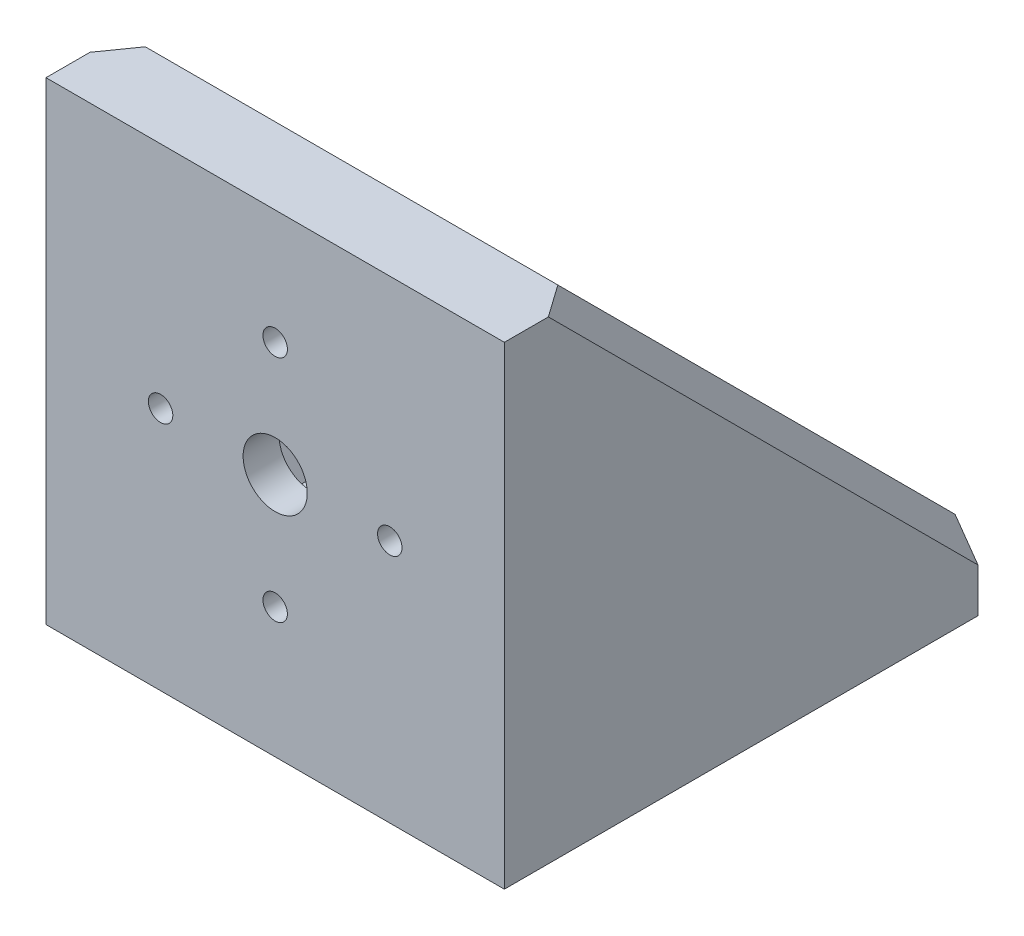
from build123d import *

# Parameters (mm, degrees)
BODY_DEPTH                       = 60
SUPPORT_ARM_DEPTH                = 10
HOLES_REACH                      = 102.737
SKETCH3_R                        = 4.2
SKETCH3_R_2                      = 1.6
SHAFT_HOLE_COUNTERBORE_DEPTH     = 5.3
MOUNTING_HOLES_COUNTERBORE_DEPTH = 3.5


with BuildPart() as part:
    # Sketch1 → Body (new body)
    with BuildSketch(Plane(origin=(0, 0, 0), x_dir=(0, 0, -1), z_dir=(1, 0, 0))):
        Polygon((0, 62), (0, 0), (62, 0), (62, 10), (10, 10), (10, 62), align=None)
    extrude(amount=BODY_DEPTH)

    # Sketch2 → Support Arm (add)
    with BuildSketch(Plane(origin=(0, 0, 0), x_dir=(0, 0, -1), z_dir=(1, 0, 0))):
        Polygon((62, 10), (10, 10), (10, 62), align=None)
    support_arm = extrude(amount=SUPPORT_ARM_DEPTH)

    # Support Arm Mirror: Support Arm across plane
    add(support_arm.mirror(Plane(origin=(30, 0, 0), x_dir=(0, 0, 1), z_dir=(1, 0, 0))))

    # Sketch3 → Holes (cut, up to next)
    with BuildSketch(Plane(origin=(0, 0, -10), x_dir=(-1, 0, 0), z_dir=(0, 0, -1)), mode=Mode.PRIVATE) as holes_sk1:
        with Locations((-30, 32)):
            Circle(SKETCH3_R)
    holes_tool1 = extrude(holes_sk1.sketch, amount=-HOLES_REACH, mode=Mode.PRIVATE) & part.part
    # Sketch3 → Holes (cut, up to next)
    with BuildSketch(Plane(origin=(0, 0, -10), x_dir=(-1, 0, 0), z_dir=(0, 0, -1)), mode=Mode.PRIVATE) as holes_sk2:
        with Locations((-30, 47)):
            Circle(SKETCH3_R_2)
    holes_tool2 = extrude(holes_sk2.sketch, amount=-HOLES_REACH, mode=Mode.PRIVATE) & part.part
    # Sketch3 → Holes (cut, up to next)
    with BuildSketch(Plane(origin=(0, 0, -10), x_dir=(-1, 0, 0), z_dir=(0, 0, -1)), mode=Mode.PRIVATE) as holes_sk3:
        with Locations((-15, 32)):
            Circle(SKETCH3_R_2)
    holes_tool3 = extrude(holes_sk3.sketch, amount=-HOLES_REACH, mode=Mode.PRIVATE) & part.part
    # Sketch3 → Holes (cut, up to next)
    with BuildSketch(Plane(origin=(0, 0, -10), x_dir=(-1, 0, 0), z_dir=(0, 0, -1)), mode=Mode.PRIVATE) as holes_sk4:
        with Locations((-30, 17)):
            Circle(SKETCH3_R_2)
    holes_tool4 = extrude(holes_sk4.sketch, amount=-HOLES_REACH, mode=Mode.PRIVATE) & part.part
    # Sketch3 → Holes (cut, up to next)
    with BuildSketch(Plane(origin=(0, 0, -10), x_dir=(-1, 0, 0), z_dir=(0, 0, -1)), mode=Mode.PRIVATE) as holes_sk5:
        with Locations((-45, 32)):
            Circle(SKETCH3_R_2)
    holes_tool5 = extrude(holes_sk5.sketch, amount=-HOLES_REACH, mode=Mode.PRIVATE) & part.part
    holes_1 = holes_tool1.solids().sort_by_distance((30, 32, -10))[0]
    add(holes_1, mode=Mode.SUBTRACT)
    holes_2 = holes_tool2.solids().sort_by_distance((30, 47, -10))[0]
    add(holes_2, mode=Mode.SUBTRACT)
    holes_3 = holes_tool3.solids().sort_by_distance((15, 32, -10))[0]
    add(holes_3, mode=Mode.SUBTRACT)
    holes_4 = holes_tool4.solids().sort_by_distance((30, 17, -10))[0]
    add(holes_4, mode=Mode.SUBTRACT)
    holes_5 = holes_tool5.solids().sort_by_distance((45, 32, -10))[0]
    add(holes_5, mode=Mode.SUBTRACT)
    holes = holes_1 + holes_2 + holes_3 + holes_4 + holes_5  # Holes as one shape, for the pattern or mirror that repeats it

    # Sketch5 → Shaft Hole Counterbore (cut)
    with BuildSketch(Plane(origin=(0, 0, -10), x_dir=(-1, 0, 0), z_dir=(0, 0, -1))):
        Polygon((-26.189488223, 38.6), (-33.810511777, 38.6), (-37.621023553, 32), (-33.810511777, 25.4), (-26.189488223, 25.4), (-22.378976447, 32), align=None)
    shaft_hole_counterbore = extrude(amount=-SHAFT_HOLE_COUNTERBORE_DEPTH, mode=Mode.SUBTRACT)

    # Sketch6 → Mounting Holes Counterbore (cut)
    with BuildSketch(Plane(origin=(0, 0, -10), x_dir=(-1, 0, 0), z_dir=(0, 0, -1))):
        Polygon((-12.15, 30.354551733), (-12.15, 33.645448267), (-15, 35.290896534), (-17.85, 33.645448267), (-17.85, 30.354551733), (-15, 28.709103466), align=None)
        Polygon((-28.354551733, 49.85), (-31.645448267, 49.85), (-33.290896534, 47), (-31.645448267, 44.15), (-28.354551733, 44.15), (-26.709103466, 47), align=None)
        Polygon((-31.645448267, 14.15), (-28.354551733, 14.15), (-26.709103466, 17), (-28.354551733, 19.85), (-31.645448267, 19.85), (-33.290896534, 17), align=None)
        Polygon((-47.85, 33.645448267), (-47.85, 30.354551733), (-45, 28.709103466), (-42.15, 30.354551733), (-42.15, 33.645448267), (-45, 35.290896534), align=None)
    mounting_holes_counterbore = extrude(amount=-MOUNTING_HOLES_COUNTERBORE_DEPTH, mode=Mode.SUBTRACT)

    # Mounting Feature Mirror: Holes, Shaft Hole Counterbore, Mounting Holes Counterbore across plane
    add(holes.mirror(Plane(origin=(0, 0, 0), x_dir=(0, -0.7071067811865489, 0.7071067811865462), z_dir=(0, 0.7071067811865464, 0.7071067811865488))), mode=Mode.SUBTRACT)
    add(shaft_hole_counterbore.mirror(Plane(origin=(0, 0, 0), x_dir=(0, -0.7071067811865489, 0.7071067811865462), z_dir=(0, 0.7071067811865464, 0.7071067811865488))), mode=Mode.SUBTRACT)
    add(mounting_holes_counterbore.mirror(Plane(origin=(0, 0, 0), x_dir=(0, -0.7071067811865489, 0.7071067811865462), z_dir=(0, 0.7071067811865464, 0.7071067811865488))), mode=Mode.SUBTRACT)

    # Chamfer1
    # the kernel refuses this chamfer: 3 mm, written as the material it adds along each edge
    with BuildSketch(Plane(origin=(48, 12, -12), x_dir=(0.7071067811865476, 0.7071067811865476, 0), z_dir=(0.5773502691896257, -0.5773502691896257, 0.5773502691896257))) as chamfer1_piece_1_section:
        Polygon((-2.121320344, -1.224744871), (2.121320344, -1.224744871), (0, 2.449489743), align=None)
    chamfer1_piece_1 = extrude(amount=3.810511777, mode=Mode.PRIVATE)
    chamfer1_piece_1 = split(chamfer1_piece_1, bisect_by=Plane(origin=(50, 10, -10), z_dir=(0, 1, 0)), keep=Keep.TOP, mode=Mode.PRIVATE)
    chamfer1_piece_1 = split(chamfer1_piece_1, bisect_by=Plane(origin=(50, 10, -10), z_dir=(-1, 0, 0)), keep=Keep.TOP, mode=Mode.PRIVATE)
    chamfer1_piece_1 = split(chamfer1_piece_1, bisect_by=Plane(origin=(50, 10, -10), z_dir=(0, 0, -1)), keep=Keep.TOP, mode=Mode.PRIVATE)
    add(chamfer1_piece_1)
    with BuildSketch(Plane(origin=(12, 12, -12), x_dir=(0.7071067811865476, -0.7071067811865476, 0), z_dir=(-0.5773502691896257, -0.5773502691896257, 0.5773502691896257))) as chamfer1_piece_2_section:
        Polygon((-2.121320344, -1.224744871), (2.121320344, -1.224744871), (0, 2.449489743), align=None)
    chamfer1_piece_2 = extrude(amount=3.810511777, mode=Mode.PRIVATE)
    chamfer1_piece_2 = split(chamfer1_piece_2, bisect_by=Plane(origin=(10, 10, -10), z_dir=(1, 0, 0)), keep=Keep.TOP, mode=Mode.PRIVATE)
    chamfer1_piece_2 = split(chamfer1_piece_2, bisect_by=Plane(origin=(10, 10, -10), z_dir=(0, 1, 0)), keep=Keep.TOP, mode=Mode.PRIVATE)
    chamfer1_piece_2 = split(chamfer1_piece_2, bisect_by=Plane(origin=(10, 10, -10), z_dir=(0, 0, -1)), keep=Keep.TOP, mode=Mode.PRIVATE)
    add(chamfer1_piece_2)
    with BuildSketch(Plane(origin=(50, 10, -62), x_dir=(-0.9996219169112968, -0.02749587661058619, 0), z_dir=(0, 0, 1))) as chamfer1_piece_3_section:
        with BuildLine():
            Line((3.086019586, 0), (-0.169641465, -3.081353381))
            Line((-0.169641465, -3.081353381), (-0.22961878, -3.079703628))
            ThreePointArc((-0.22961878, -3.079703628), (-0.102387681, -1.540193489), (-0.059977315, 0.001649753))
            Line((-0.059977315, 0.001649753), (0.001649753, 0.059977315))
            ThreePointArc((0.001649753, 0.059977315), (1.543492994, 0.017566949), (3.087669338, 0.059977315))
            Line((3.087669338, 0.059977315), (3.086019586, 0))
        make_face()
    chamfer1_piece_3 = extrude(amount=59.715048964, mode=Mode.PRIVATE)
    chamfer1_piece_3 = split(chamfer1_piece_3, bisect_by=Plane(origin=(47.520469287, 17.200125575, -54.799874425), z_dir=(0, -0.7071067811865476, 0.7071067811865476)), keep=Keep.TOP, mode=Mode.PRIVATE)
    chamfer1_piece_3 = split(chamfer1_piece_3, bisect_by=Plane(origin=(47.85, 10.207829638, -47.807578488), z_dir=(-1, 0, 0)), keep=Keep.TOP, mode=Mode.PRIVATE)
    chamfer1_piece_3 = split(chamfer1_piece_3, bisect_by=Plane(origin=(41.470469694, 10.207829638, -37.328671807), z_dir=(0.5000000000000014, 6.5682216370568426e-15, -0.8660254037844379)), keep=Keep.TOP, mode=Mode.PRIVATE)
    add(chamfer1_piece_3)
    with BuildSketch(Plane(origin=(50, 10, -62), x_dir=(-0.9996219169112968, -0.02749587661058619, 0), z_dir=(0, 0, 1))) as chamfer1_piece_4_section:
        with BuildLine():
            Line((3.086019586, 0), (-0.169641465, -3.081353381))
            Line((-0.169641465, -3.081353381), (-0.22961878, -3.079703628))
            ThreePointArc((-0.22961878, -3.079703628), (-0.102387681, -1.540193489), (-0.059977315, 0.001649753))
            Line((-0.059977315, 0.001649753), (0.001649753, 0.059977315))
            ThreePointArc((0.001649753, 0.059977315), (1.543492994, 0.017566949), (3.087669338, 0.059977315))
            Line((3.087669338, 0.059977315), (3.086019586, 0))
        make_face()
    chamfer1_piece_4 = extrude(amount=59.715048964, mode=Mode.PRIVATE)
    chamfer1_piece_4 = split(chamfer1_piece_4, bisect_by=Plane(origin=(49.164389767, 18.069084369, -53.930915631), z_dir=(0, -0.7071067811865476, 0.7071067811865476)), keep=Keep.TOP, mode=Mode.PRIVATE)
    chamfer1_piece_4 = split(chamfer1_piece_4, bisect_by=Plane(origin=(47.85, 11.05402215, -46.915853412), z_dir=(1, 0, 0)), keep=Keep.TOP, mode=Mode.PRIVATE)
    chamfer1_piece_4 = split(chamfer1_piece_4, bisect_by=Plane(origin=(43.089538338, 11.05402215, -36.393902089), z_dir=(0.5000000000000014, 6.5682216370568426e-15, -0.8660254037844379)), keep=Keep.TOP, mode=Mode.PRIVATE)
    add(chamfer1_piece_4)
    with BuildSketch(Plane(origin=(50, 10, -62), x_dir=(-0.9996219169112968, -0.02749587661058619, 0), z_dir=(0, 0, 1))) as chamfer1_piece_5_section:
        with BuildLine():
            Line((3.086019586, 0), (-0.169641465, -3.081353381))
            Line((-0.169641465, -3.081353381), (-0.22961878, -3.079703628))
            ThreePointArc((-0.22961878, -3.079703628), (-0.102387681, -1.540193489), (-0.059977315, 0.001649753))
            Line((-0.059977315, 0.001649753), (0.001649753, 0.059977315))
            ThreePointArc((0.001649753, 0.059977315), (1.543492994, 0.017566949), (3.087669338, 0.059977315))
            Line((3.087669338, 0.059977315), (3.086019586, 0))
        make_face()
    chamfer1_piece_5 = extrude(amount=59.715048964, mode=Mode.PRIVATE)
    chamfer1_piece_5 = split(chamfer1_piece_5, bisect_by=Plane(origin=(47.85, 10.93810197, -32), z_dir=(1, 0, 0)), keep=Keep.TOP, mode=Mode.PRIVATE)
    chamfer1_piece_5 = split(chamfer1_piece_5, bisect_by=Plane(origin=(49.365911498, 10.93810197, -31.229763644), z_dir=(-0.5000000000000003, 0, -0.8660254037844385)), keep=Keep.TOP, mode=Mode.PRIVATE)
    chamfer1_piece_5 = split(chamfer1_piece_5, bisect_by=Plane(origin=(49.365911498, 10.93810197, -32.770236356), z_dir=(-0.5000000000000014, -6.5682216370568426e-15, 0.8660254037844379)), keep=Keep.TOP, mode=Mode.PRIVATE)
    add(chamfer1_piece_5)
    with BuildSketch(Plane(origin=(50, 10, -62), x_dir=(-0.9996219169112968, -0.02749587661058619, 0), z_dir=(0, 0, 1))) as chamfer1_piece_6_section:
        with BuildLine():
            Line((3.086019586, 0), (-0.169641465, -3.081353381))
            Line((-0.169641465, -3.081353381), (-0.22961878, -3.079703628))
            ThreePointArc((-0.22961878, -3.079703628), (-0.102387681, -1.540193489), (-0.059977315, 0.001649753))
            Line((-0.059977315, 0.001649753), (0.001649753, 0.059977315))
            ThreePointArc((0.001649753, 0.059977315), (1.543492994, 0.017566949), (3.087669338, 0.059977315))
            Line((3.087669338, 0.059977315), (3.086019586, 0))
        make_face()
    chamfer1_piece_6 = extrude(amount=59.715048964, mode=Mode.PRIVATE)
    chamfer1_piece_6 = split(chamfer1_piece_6, bisect_by=Plane(origin=(47.85, 10.209544555, -16.224893172), z_dir=(-1, 0, 0)), keep=Keep.TOP, mode=Mode.PRIVATE)
    chamfer1_piece_6 = split(chamfer1_piece_6, bisect_by=Plane(origin=(41.485229504, 10.209544555, -26.679849774), z_dir=(0.5000000000000003, 0, 0.8660254037844385)), keep=Keep.TOP, mode=Mode.PRIVATE)
    add(chamfer1_piece_6)
    with BuildSketch(Plane(origin=(50, 10, -62), x_dir=(-0.9996219169112968, -0.02749587661058619, 0), z_dir=(0, 0, 1))) as chamfer1_piece_7_section:
        with BuildLine():
            Line((3.086019586, 0), (-0.169641465, -3.081353381))
            Line((-0.169641465, -3.081353381), (-0.22961878, -3.079703628))
            ThreePointArc((-0.22961878, -3.079703628), (-0.102387681, -1.540193489), (-0.059977315, 0.001649753))
            Line((-0.059977315, 0.001649753), (0.001649753, 0.059977315))
            ThreePointArc((0.001649753, 0.059977315), (1.543492994, 0.017566949), (3.087669338, 0.059977315))
            Line((3.087669338, 0.059977315), (3.086019586, 0))
        make_face()
    chamfer1_piece_7 = extrude(amount=59.715048964, mode=Mode.PRIVATE)
    chamfer1_piece_7 = split(chamfer1_piece_7, bisect_by=Plane(origin=(47.85, 11.073699884, -16.701199578), z_dir=(1, 0, 0)), keep=Keep.TOP, mode=Mode.PRIVATE)
    chamfer1_piece_7 = split(chamfer1_piece_7, bisect_by=Plane(origin=(42.928956571, 11.073699884, -27.513385984), z_dir=(0.5000000000000003, 0, 0.8660254037844385)), keep=Keep.TOP, mode=Mode.PRIVATE)
    add(chamfer1_piece_7)
    with BuildSketch(Plane(origin=(50, 2.284951036, -10), x_dir=(-0.9996219169112968, 0, 0.02749587661058619), z_dir=(0, 1, 0))) as chamfer1_piece_8_section:
        with BuildLine():
            Line((3.086019586, 0), (-0.169641465, -3.081353381))
            Line((-0.169641465, -3.081353381), (-0.22961878, -3.079703628))
            ThreePointArc((-0.22961878, -3.079703628), (-0.102387681, -1.540193489), (-0.059977315, 0.001649753))
            Line((-0.059977315, 0.001649753), (0.001649753, 0.059977315))
            ThreePointArc((0.001649753, 0.059977315), (1.543492994, 0.017566949), (3.087669338, 0.059977315))
            Line((3.087669338, 0.059977315), (3.086019586, 0))
        make_face()
    chamfer1_piece_8 = extrude(amount=59.715048964, mode=Mode.PRIVATE)
    chamfer1_piece_8 = split(chamfer1_piece_8, bisect_by=Plane(origin=(41.485229504, 26.679849774, -10.209544555), z_dir=(0.5000000000000003, -0.8660254037844387, -3.4914813388431365e-15)), keep=Keep.TOP, mode=Mode.PRIVATE)
    chamfer1_piece_8 = split(chamfer1_piece_8, bisect_by=Plane(origin=(47.85, 16.224893172, -10.209544555), z_dir=(-1, 0, 0)), keep=Keep.TOP, mode=Mode.PRIVATE)
    add(chamfer1_piece_8)
    with BuildSketch(Plane(origin=(50, 2.284951036, -10), x_dir=(-0.9996219169112968, 0, 0.02749587661058619), z_dir=(0, 1, 0))) as chamfer1_piece_9_section:
        with BuildLine():
            Line((3.086019586, 0), (-0.169641465, -3.081353381))
            Line((-0.169641465, -3.081353381), (-0.22961878, -3.079703628))
            ThreePointArc((-0.22961878, -3.079703628), (-0.102387681, -1.540193489), (-0.059977315, 0.001649753))
            Line((-0.059977315, 0.001649753), (0.001649753, 0.059977315))
            ThreePointArc((0.001649753, 0.059977315), (1.543492994, 0.017566949), (3.087669338, 0.059977315))
            Line((3.087669338, 0.059977315), (3.086019586, 0))
        make_face()
    chamfer1_piece_9 = extrude(amount=59.715048964, mode=Mode.PRIVATE)
    chamfer1_piece_9 = split(chamfer1_piece_9, bisect_by=Plane(origin=(42.928956571, 27.513385984, -11.073699884), z_dir=(0.5000000000000003, -0.8660254037844387, -3.4914813388431365e-15)), keep=Keep.TOP, mode=Mode.PRIVATE)
    chamfer1_piece_9 = split(chamfer1_piece_9, bisect_by=Plane(origin=(47.85, 16.701199578, -11.073699884), z_dir=(1, 0, 0)), keep=Keep.TOP, mode=Mode.PRIVATE)
    add(chamfer1_piece_9)
    with BuildSketch(Plane(origin=(50, 2.284951036, -10), x_dir=(-0.9996219169112968, 0, 0.02749587661058619), z_dir=(0, 1, 0))) as chamfer1_piece_10_section:
        with BuildLine():
            Line((3.086019586, 0), (-0.169641465, -3.081353381))
            Line((-0.169641465, -3.081353381), (-0.22961878, -3.079703628))
            ThreePointArc((-0.22961878, -3.079703628), (-0.102387681, -1.540193489), (-0.059977315, 0.001649753))
            Line((-0.059977315, 0.001649753), (0.001649753, 0.059977315))
            ThreePointArc((0.001649753, 0.059977315), (1.543492994, 0.017566949), (3.087669338, 0.059977315))
            Line((3.087669338, 0.059977315), (3.086019586, 0))
        make_face()
    chamfer1_piece_10 = extrude(amount=59.715048964, mode=Mode.PRIVATE)
    chamfer1_piece_10 = split(chamfer1_piece_10, bisect_by=Plane(origin=(49.365911498, 32.770236356, -10.93810197), z_dir=(-0.5000000000000013, -0.8660254037844379, 3.4914813388431432e-15)), keep=Keep.TOP, mode=Mode.PRIVATE)
    chamfer1_piece_10 = split(chamfer1_piece_10, bisect_by=Plane(origin=(49.365911498, 31.229763644, -10.93810197), z_dir=(-0.5000000000000003, 0.8660254037844387, 3.4914813388431365e-15)), keep=Keep.TOP, mode=Mode.PRIVATE)
    chamfer1_piece_10 = split(chamfer1_piece_10, bisect_by=Plane(origin=(47.85, 32, -10.93810197), z_dir=(1, 0, 0)), keep=Keep.TOP, mode=Mode.PRIVATE)
    add(chamfer1_piece_10)
    with BuildSketch(Plane(origin=(50, 2.284951036, -10), x_dir=(-0.9996219169112968, 0, 0.02749587661058619), z_dir=(0, 1, 0))) as chamfer1_piece_11_section:
        with BuildLine():
            Line((3.086019586, 0), (-0.169641465, -3.081353381))
            Line((-0.169641465, -3.081353381), (-0.22961878, -3.079703628))
            ThreePointArc((-0.22961878, -3.079703628), (-0.102387681, -1.540193489), (-0.059977315, 0.001649753))
            Line((-0.059977315, 0.001649753), (0.001649753, 0.059977315))
            ThreePointArc((0.001649753, 0.059977315), (1.543492994, 0.017566949), (3.087669338, 0.059977315))
            Line((3.087669338, 0.059977315), (3.086019586, 0))
        make_face()
    chamfer1_piece_11 = extrude(amount=59.715048964, mode=Mode.PRIVATE)
    chamfer1_piece_11 = split(chamfer1_piece_11, bisect_by=Plane(origin=(41.470469694, 37.328671807, -10.207829638), z_dir=(0.5000000000000013, 0.8660254037844379, -3.4914813388431432e-15)), keep=Keep.TOP, mode=Mode.PRIVATE)
    chamfer1_piece_11 = split(chamfer1_piece_11, bisect_by=Plane(origin=(47.85, 47.807578488, -10.207829638), z_dir=(-1, 0, 0)), keep=Keep.TOP, mode=Mode.PRIVATE)
    chamfer1_piece_11 = split(chamfer1_piece_11, bisect_by=Plane(origin=(47.520469287, 54.799874425, -17.200125575), z_dir=(0, -0.7071067811865476, 0.7071067811865476)), keep=Keep.TOP, mode=Mode.PRIVATE)
    add(chamfer1_piece_11)
    with BuildSketch(Plane(origin=(50, 2.284951036, -10), x_dir=(-0.9996219169112968, 0, 0.02749587661058619), z_dir=(0, 1, 0))) as chamfer1_piece_12_section:
        with BuildLine():
            Line((3.086019586, 0), (-0.169641465, -3.081353381))
            Line((-0.169641465, -3.081353381), (-0.22961878, -3.079703628))
            ThreePointArc((-0.22961878, -3.079703628), (-0.102387681, -1.540193489), (-0.059977315, 0.001649753))
            Line((-0.059977315, 0.001649753), (0.001649753, 0.059977315))
            ThreePointArc((0.001649753, 0.059977315), (1.543492994, 0.017566949), (3.087669338, 0.059977315))
            Line((3.087669338, 0.059977315), (3.086019586, 0))
        make_face()
    chamfer1_piece_12 = extrude(amount=59.715048964, mode=Mode.PRIVATE)
    chamfer1_piece_12 = split(chamfer1_piece_12, bisect_by=Plane(origin=(43.089538338, 36.393902089, -11.05402215), z_dir=(0.5000000000000013, 0.8660254037844379, -3.4914813388431432e-15)), keep=Keep.TOP, mode=Mode.PRIVATE)
    chamfer1_piece_12 = split(chamfer1_piece_12, bisect_by=Plane(origin=(47.85, 46.915853412, -11.05402215), z_dir=(1, 0, 0)), keep=Keep.TOP, mode=Mode.PRIVATE)
    chamfer1_piece_12 = split(chamfer1_piece_12, bisect_by=Plane(origin=(49.164389767, 53.930915631, -18.069084369), z_dir=(0, -0.7071067811865476, 0.7071067811865476)), keep=Keep.TOP, mode=Mode.PRIVATE)
    add(chamfer1_piece_12)
    with BuildSketch(Plane(origin=(10, 10, -62), x_dir=(-0.027495876610586206, 0.9996219169112968, 0), z_dir=(0, 0, 1))) as chamfer1_piece_13_section:
        with BuildLine():
            Line((3.086019586, 0), (-0.169641465, -3.081353381))
            Line((-0.169641465, -3.081353381), (-0.22961878, -3.079703628))
            ThreePointArc((-0.22961878, -3.079703628), (-0.102387681, -1.540193489), (-0.059977315, 0.001649753))
            Line((-0.059977315, 0.001649753), (0.001649753, 0.059977315))
            ThreePointArc((0.001649753, 0.059977315), (1.543492994, 0.017566949), (3.087669338, 0.059977315))
            Line((3.087669338, 0.059977315), (3.086019586, 0))
        make_face()
    chamfer1_piece_13 = extrude(amount=59.715048964, mode=Mode.PRIVATE)
    chamfer1_piece_13 = split(chamfer1_piece_13, bisect_by=Plane(origin=(10.835610233, 18.069084369, -53.930915631), z_dir=(0, -0.7071067811865476, 0.7071067811865476)), keep=Keep.TOP, mode=Mode.PRIVATE)
    chamfer1_piece_13 = split(chamfer1_piece_13, bisect_by=Plane(origin=(12.15, 11.05402215, -46.915853412), z_dir=(-1, 0, 0)), keep=Keep.TOP, mode=Mode.PRIVATE)
    chamfer1_piece_13 = split(chamfer1_piece_13, bisect_by=Plane(origin=(16.910461662, 11.05402215, -36.393902089), z_dir=(-0.4999999999999997, 0, -0.8660254037844388)), keep=Keep.TOP, mode=Mode.PRIVATE)
    add(chamfer1_piece_13)
    with BuildSketch(Plane(origin=(10, 10, -62), x_dir=(-0.027495876610586206, 0.9996219169112968, 0), z_dir=(0, 0, 1))) as chamfer1_piece_14_section:
        with BuildLine():
            Line((3.086019586, 0), (-0.169641465, -3.081353381))
            Line((-0.169641465, -3.081353381), (-0.22961878, -3.079703628))
            ThreePointArc((-0.22961878, -3.079703628), (-0.102387681, -1.540193489), (-0.059977315, 0.001649753))
            Line((-0.059977315, 0.001649753), (0.001649753, 0.059977315))
            ThreePointArc((0.001649753, 0.059977315), (1.543492994, 0.017566949), (3.087669338, 0.059977315))
            Line((3.087669338, 0.059977315), (3.086019586, 0))
        make_face()
    chamfer1_piece_14 = extrude(amount=59.715048964, mode=Mode.PRIVATE)
    chamfer1_piece_14 = split(chamfer1_piece_14, bisect_by=Plane(origin=(12.479530713, 17.200125575, -54.799874425), z_dir=(0, -0.7071067811865476, 0.7071067811865476)), keep=Keep.TOP, mode=Mode.PRIVATE)
    chamfer1_piece_14 = split(chamfer1_piece_14, bisect_by=Plane(origin=(12.15, 10.207829638, -47.807578488), z_dir=(1, 0, 0)), keep=Keep.TOP, mode=Mode.PRIVATE)
    chamfer1_piece_14 = split(chamfer1_piece_14, bisect_by=Plane(origin=(18.529530306, 10.207829638, -37.328671807), z_dir=(-0.4999999999999997, 0, -0.8660254037844388)), keep=Keep.TOP, mode=Mode.PRIVATE)
    add(chamfer1_piece_14)
    with BuildSketch(Plane(origin=(10, 10, -62), x_dir=(-0.027495876610586206, 0.9996219169112968, 0), z_dir=(0, 0, 1))) as chamfer1_piece_15_section:
        with BuildLine():
            Line((3.086019586, 0), (-0.169641465, -3.081353381))
            Line((-0.169641465, -3.081353381), (-0.22961878, -3.079703628))
            ThreePointArc((-0.22961878, -3.079703628), (-0.102387681, -1.540193489), (-0.059977315, 0.001649753))
            Line((-0.059977315, 0.001649753), (0.001649753, 0.059977315))
            ThreePointArc((0.001649753, 0.059977315), (1.543492994, 0.017566949), (3.087669338, 0.059977315))
            Line((3.087669338, 0.059977315), (3.086019586, 0))
        make_face()
    chamfer1_piece_15 = extrude(amount=59.715048964, mode=Mode.PRIVATE)
    chamfer1_piece_15 = split(chamfer1_piece_15, bisect_by=Plane(origin=(12.15, 10.93810197, -32), z_dir=(-1, 0, 0)), keep=Keep.TOP, mode=Mode.PRIVATE)
    chamfer1_piece_15 = split(chamfer1_piece_15, bisect_by=Plane(origin=(10.634088502, 10.93810197, -32.770236356), z_dir=(0.4999999999999997, 0, 0.8660254037844388)), keep=Keep.TOP, mode=Mode.PRIVATE)
    chamfer1_piece_15 = split(chamfer1_piece_15, bisect_by=Plane(origin=(10.634088502, 10.93810197, -31.229763644), z_dir=(0.5000000000000008, 6.568221637056838e-15, -0.8660254037844384)), keep=Keep.TOP, mode=Mode.PRIVATE)
    add(chamfer1_piece_15)
    with BuildSketch(Plane(origin=(10, 10, -62), x_dir=(-0.027495876610586206, 0.9996219169112968, 0), z_dir=(0, 0, 1))) as chamfer1_piece_16_section:
        with BuildLine():
            Line((3.086019586, 0), (-0.169641465, -3.081353381))
            Line((-0.169641465, -3.081353381), (-0.22961878, -3.079703628))
            ThreePointArc((-0.22961878, -3.079703628), (-0.102387681, -1.540193489), (-0.059977315, 0.001649753))
            Line((-0.059977315, 0.001649753), (0.001649753, 0.059977315))
            ThreePointArc((0.001649753, 0.059977315), (1.543492994, 0.017566949), (3.087669338, 0.059977315))
            Line((3.087669338, 0.059977315), (3.086019586, 0))
        make_face()
    chamfer1_piece_16 = extrude(amount=59.715048964, mode=Mode.PRIVATE)
    chamfer1_piece_16 = split(chamfer1_piece_16, bisect_by=Plane(origin=(12.15, 11.073699884, -16.701199578), z_dir=(-1, 0, 0)), keep=Keep.TOP, mode=Mode.PRIVATE)
    chamfer1_piece_16 = split(chamfer1_piece_16, bisect_by=Plane(origin=(17.071043429, 11.073699884, -27.513385984), z_dir=(-0.5000000000000008, -6.568221637056838e-15, 0.8660254037844384)), keep=Keep.TOP, mode=Mode.PRIVATE)
    add(chamfer1_piece_16)
    with BuildSketch(Plane(origin=(10, 10, -62), x_dir=(-0.027495876610586206, 0.9996219169112968, 0), z_dir=(0, 0, 1))) as chamfer1_piece_17_section:
        with BuildLine():
            Line((3.086019586, 0), (-0.169641465, -3.081353381))
            Line((-0.169641465, -3.081353381), (-0.22961878, -3.079703628))
            ThreePointArc((-0.22961878, -3.079703628), (-0.102387681, -1.540193489), (-0.059977315, 0.001649753))
            Line((-0.059977315, 0.001649753), (0.001649753, 0.059977315))
            ThreePointArc((0.001649753, 0.059977315), (1.543492994, 0.017566949), (3.087669338, 0.059977315))
            Line((3.087669338, 0.059977315), (3.086019586, 0))
        make_face()
    chamfer1_piece_17 = extrude(amount=59.715048964, mode=Mode.PRIVATE)
    chamfer1_piece_17 = split(chamfer1_piece_17, bisect_by=Plane(origin=(12.15, 10.209544555, -16.224893172), z_dir=(1, 0, 0)), keep=Keep.TOP, mode=Mode.PRIVATE)
    chamfer1_piece_17 = split(chamfer1_piece_17, bisect_by=Plane(origin=(18.514770496, 10.209544555, -26.679849774), z_dir=(-0.5000000000000008, -6.568221637056838e-15, 0.8660254037844384)), keep=Keep.TOP, mode=Mode.PRIVATE)
    add(chamfer1_piece_17)
    with BuildSketch(Plane(origin=(10, 2.284951036, -10), x_dir=(0.9996219169112969, 0, 0.02749587661058621), z_dir=(0, 1, 0))) as chamfer1_piece_18_section:
        with BuildLine():
            Line((3.086019586, 0), (-0.169641465, 3.081353381))
            Line((-0.169641465, 3.081353381), (-0.22961878, 3.079703628))
            ThreePointArc((-0.22961878, 3.079703628), (-0.102387681, 1.540193489), (-0.059977315, -0.001649753))
            Line((-0.059977315, -0.001649753), (0.001649753, -0.059977315))
            ThreePointArc((0.001649753, -0.059977315), (1.543492994, -0.017566949), (3.087669338, -0.059977315))
            Line((3.087669338, -0.059977315), (3.086019586, 0))
        make_face()
    chamfer1_piece_18 = extrude(amount=59.715048964, mode=Mode.PRIVATE)
    chamfer1_piece_18 = split(chamfer1_piece_18, bisect_by=Plane(origin=(18.514770496, 26.679849774, -10.209544555), z_dir=(-0.5000000000000007, -0.8660254037844384, 3.491481338843138e-15)), keep=Keep.TOP, mode=Mode.PRIVATE)
    chamfer1_piece_18 = split(chamfer1_piece_18, bisect_by=Plane(origin=(12.15, 16.224893172, -10.209544555), z_dir=(1, 0, 0)), keep=Keep.TOP, mode=Mode.PRIVATE)
    add(chamfer1_piece_18)
    with BuildSketch(Plane(origin=(10, 2.284951036, -10), x_dir=(0.9996219169112969, 0, 0.02749587661058621), z_dir=(0, 1, 0))) as chamfer1_piece_19_section:
        with BuildLine():
            Line((3.086019586, 0), (-0.169641465, 3.081353381))
            Line((-0.169641465, 3.081353381), (-0.22961878, 3.079703628))
            ThreePointArc((-0.22961878, 3.079703628), (-0.102387681, 1.540193489), (-0.059977315, -0.001649753))
            Line((-0.059977315, -0.001649753), (0.001649753, -0.059977315))
            ThreePointArc((0.001649753, -0.059977315), (1.543492994, -0.017566949), (3.087669338, -0.059977315))
            Line((3.087669338, -0.059977315), (3.086019586, 0))
        make_face()
    chamfer1_piece_19 = extrude(amount=59.715048964, mode=Mode.PRIVATE)
    chamfer1_piece_19 = split(chamfer1_piece_19, bisect_by=Plane(origin=(17.071043429, 27.513385984, -11.073699884), z_dir=(-0.5000000000000007, -0.8660254037844384, 3.491481338843138e-15)), keep=Keep.TOP, mode=Mode.PRIVATE)
    chamfer1_piece_19 = split(chamfer1_piece_19, bisect_by=Plane(origin=(12.15, 16.701199578, -11.073699884), z_dir=(-1, 0, 0)), keep=Keep.TOP, mode=Mode.PRIVATE)
    add(chamfer1_piece_19)
    with BuildSketch(Plane(origin=(10, 2.284951036, -10), x_dir=(0.9996219169112969, 0, 0.02749587661058621), z_dir=(0, 1, 0))) as chamfer1_piece_20_section:
        with BuildLine():
            Line((3.086019586, 0), (-0.169641465, 3.081353381))
            Line((-0.169641465, 3.081353381), (-0.22961878, 3.079703628))
            ThreePointArc((-0.22961878, 3.079703628), (-0.102387681, 1.540193489), (-0.059977315, -0.001649753))
            Line((-0.059977315, -0.001649753), (0.001649753, -0.059977315))
            ThreePointArc((0.001649753, -0.059977315), (1.543492994, -0.017566949), (3.087669338, -0.059977315))
            Line((3.087669338, -0.059977315), (3.086019586, 0))
        make_face()
    chamfer1_piece_20 = extrude(amount=59.715048964, mode=Mode.PRIVATE)
    chamfer1_piece_20 = split(chamfer1_piece_20, bisect_by=Plane(origin=(10.634088502, 31.229763644, -10.93810197), z_dir=(0.5000000000000007, 0.8660254037844384, -3.491481338843138e-15)), keep=Keep.TOP, mode=Mode.PRIVATE)
    chamfer1_piece_20 = split(chamfer1_piece_20, bisect_by=Plane(origin=(10.634088502, 32.770236356, -10.93810197), z_dir=(0.4999999999999997, -0.866025403784439, -3.4914813388431314e-15)), keep=Keep.TOP, mode=Mode.PRIVATE)
    chamfer1_piece_20 = split(chamfer1_piece_20, bisect_by=Plane(origin=(12.15, 32, -10.93810197), z_dir=(-1, 0, 0)), keep=Keep.TOP, mode=Mode.PRIVATE)
    add(chamfer1_piece_20)
    with BuildSketch(Plane(origin=(10, 2.284951036, -10), x_dir=(0.9996219169112969, 0, 0.02749587661058621), z_dir=(0, 1, 0))) as chamfer1_piece_21_section:
        with BuildLine():
            Line((3.086019586, 0), (-0.169641465, 3.081353381))
            Line((-0.169641465, 3.081353381), (-0.22961878, 3.079703628))
            ThreePointArc((-0.22961878, 3.079703628), (-0.102387681, 1.540193489), (-0.059977315, -0.001649753))
            Line((-0.059977315, -0.001649753), (0.001649753, -0.059977315))
            ThreePointArc((0.001649753, -0.059977315), (1.543492994, -0.017566949), (3.087669338, -0.059977315))
            Line((3.087669338, -0.059977315), (3.086019586, 0))
        make_face()
    chamfer1_piece_21 = extrude(amount=59.715048964, mode=Mode.PRIVATE)
    chamfer1_piece_21 = split(chamfer1_piece_21, bisect_by=Plane(origin=(12.479530713, 54.799874425, -17.200125575), z_dir=(0, -0.7071067811865476, 0.7071067811865476)), keep=Keep.TOP, mode=Mode.PRIVATE)
    chamfer1_piece_21 = split(chamfer1_piece_21, bisect_by=Plane(origin=(18.529530306, 37.328671807, -10.207829638), z_dir=(-0.4999999999999997, 0.866025403784439, 3.4914813388431314e-15)), keep=Keep.TOP, mode=Mode.PRIVATE)
    chamfer1_piece_21 = split(chamfer1_piece_21, bisect_by=Plane(origin=(12.15, 47.807578488, -10.207829638), z_dir=(1, 0, 0)), keep=Keep.TOP, mode=Mode.PRIVATE)
    add(chamfer1_piece_21)
    with BuildSketch(Plane(origin=(10, 2.284951036, -10), x_dir=(0.9996219169112969, 0, 0.02749587661058621), z_dir=(0, 1, 0))) as chamfer1_piece_22_section:
        with BuildLine():
            Line((3.086019586, 0), (-0.169641465, 3.081353381))
            Line((-0.169641465, 3.081353381), (-0.22961878, 3.079703628))
            ThreePointArc((-0.22961878, 3.079703628), (-0.102387681, 1.540193489), (-0.059977315, -0.001649753))
            Line((-0.059977315, -0.001649753), (0.001649753, -0.059977315))
            ThreePointArc((0.001649753, -0.059977315), (1.543492994, -0.017566949), (3.087669338, -0.059977315))
            Line((3.087669338, -0.059977315), (3.086019586, 0))
        make_face()
    chamfer1_piece_22 = extrude(amount=59.715048964, mode=Mode.PRIVATE)
    chamfer1_piece_22 = split(chamfer1_piece_22, bisect_by=Plane(origin=(10.835610233, 53.930915631, -18.069084369), z_dir=(0, -0.7071067811865476, 0.7071067811865476)), keep=Keep.TOP, mode=Mode.PRIVATE)
    chamfer1_piece_22 = split(chamfer1_piece_22, bisect_by=Plane(origin=(16.910461662, 36.393902089, -11.05402215), z_dir=(-0.4999999999999997, 0.866025403784439, 3.4914813388431314e-15)), keep=Keep.TOP, mode=Mode.PRIVATE)
    chamfer1_piece_22 = split(chamfer1_piece_22, bisect_by=Plane(origin=(12.15, 46.915853412, -11.05402215), z_dir=(-1, 0, 0)), keep=Keep.TOP, mode=Mode.PRIVATE)
    add(chamfer1_piece_22)
    with BuildSketch(Plane(origin=(2.284951036, 10, -10), x_dir=(0, 0.9996219169112969, 0.02749587661058621), z_dir=(1, 0, 0))) as chamfer1_piece_23:
        with BuildLine():
            Line((3.086019586, 0), (-0.169641465, -3.081353381))
            Line((-0.169641465, -3.081353381), (-0.22961878, -3.079703628))
            ThreePointArc((-0.22961878, -3.079703628), (-0.102387681, -1.540193489), (-0.059977315, 0.001649753))
            Line((-0.059977315, 0.001649753), (0.001649753, 0.059977315))
            ThreePointArc((0.001649753, 0.059977315), (1.543492994, 0.017566949), (3.087669338, 0.059977315))
            Line((3.087669338, 0.059977315), (3.086019586, 0))
        make_face()
    extrude(amount=55.430097928)
    # the kernel refuses this chamfer: 3 mm, written as the material it takes off along each edge
    with BuildSketch(Plane(origin=(0, 67.45536344, -4.54463656), x_dir=(0.9996219169112968, 0.019442520806015665, -0.019442520806015665), z_dir=(0, -0.7071067811865476, -0.7071067811865476))) as chamfer1_2_piece_1:
        with BuildLine():
            Line((3.086019586, 0), (-0.169641465, 3.081353381))
            Line((-0.169641465, 3.081353381), (-0.22961878, 3.079703628))
            ThreePointArc((-0.22961878, 3.079703628), (-0.102387681, 1.540193489), (-0.059977315, -0.001649753))
            Line((-0.059977315, -0.001649753), (0.001649753, -0.059977315))
            ThreePointArc((0.001649753, -0.059977315), (1.543492994, -0.017566949), (3.087669338, -0.059977315))
            Line((3.087669338, -0.059977315), (3.086019586, 0))
        make_face()
    extrude(amount=88.969203171, mode=Mode.SUBTRACT)
    with BuildSketch(Plane(origin=(60, 67.45536344, -4.54463656), x_dir=(-0.9996219169112965, 0.01944252080601551, -0.01944252080601551), z_dir=(0, -0.7071067811865476, -0.7071067811865476))) as chamfer1_2_piece_2:
        with BuildLine():
            Line((3.086019586, 0), (-0.169641465, -3.081353381))
            Line((-0.169641465, -3.081353381), (-0.22961878, -3.079703628))
            ThreePointArc((-0.22961878, -3.079703628), (-0.102387681, -1.540193489), (-0.059977315, 0.001649753))
            Line((-0.059977315, 0.001649753), (0.001649753, 0.059977315))
            ThreePointArc((0.001649753, 0.059977315), (1.543492994, 0.017566949), (3.087669338, 0.059977315))
            Line((3.087669338, 0.059977315), (3.086019586, 0))
        make_face()
    extrude(amount=88.969203171, mode=Mode.SUBTRACT)


solid = part.part
